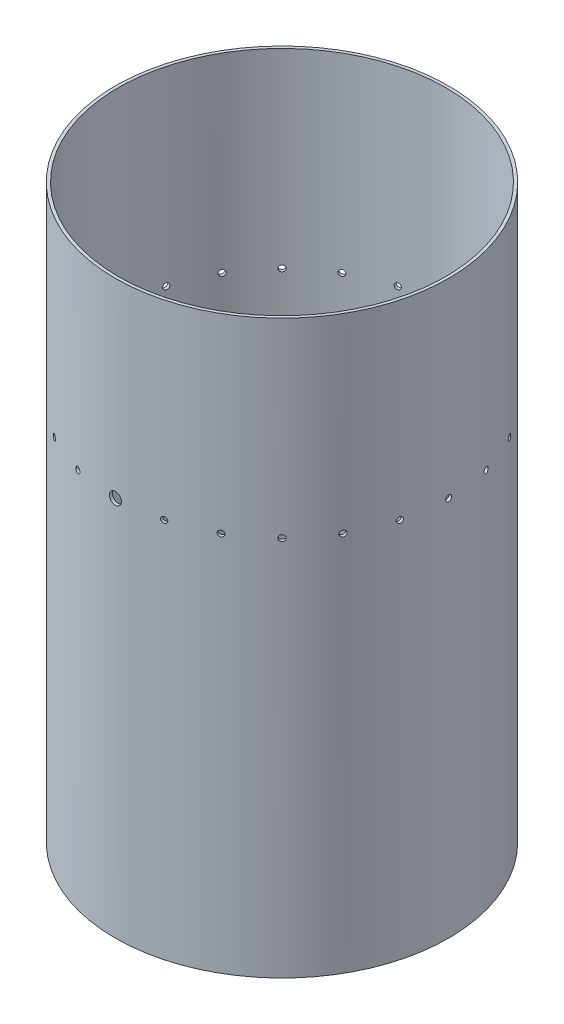
from build123d import *

# Parameters (mm, degrees)
SKETCH1_R               = 88.9
SKETCH1_R_2             = 87.3125
BOSS_EXTRUDE1_DEPTH     = 304.8
SKETCH10_R              = 1.5875
CUT_EXTRUDE1_DEPTH      = 3.81
CIRPATTERN1_COUNT       = 24
CUT_EXTRUDE2_DEPTH      = 364.89433922
CUT_EXTRUDE2_DEPTH_BACK = 364.89433922
SKETCH12_R              = 3.175


with BuildPart() as part:
    # Sketch1 → Boss-Extrude1 (new body)
    with BuildSketch(Plane(origin=(0, 0, 0), x_dir=(1, 0, 0), z_dir=(0, 1, 0))):
        Circle(SKETCH1_R)
        Circle(SKETCH1_R_2, mode=Mode.SUBTRACT)
    extrude(amount=BOSS_EXTRUDE1_DEPTH)

    # Sketch10 → Cut-Extrude1 (cut)
    with BuildSketch(Plane.XY.offset(88.9)):
        with Locations((0, 203.2)):
            Circle(SKETCH10_R)
    cut_extrude1 = extrude(amount=-CUT_EXTRUDE1_DEPTH, mode=Mode.SUBTRACT)

    # CirPattern1: Cut-Extrude1 ×24 about axis
    cirpattern1_axis = Axis((0, 304.8, 0), (0, -1, 0))
    for i in range(1, CIRPATTERN1_COUNT):
        add(cut_extrude1.rotate(cirpattern1_axis, i * 360 / CIRPATTERN1_COUNT), mode=Mode.SUBTRACT)

    # Sketch12 → Cut-Extrude2 (cut, two sides: drawn at the far end of the back side and taken through both)
    with BuildSketch(Plane.XY.offset(88.9).offset(-CUT_EXTRUDE2_DEPTH_BACK)):
        with Locations((0, 203.2)):
            Circle(SKETCH12_R)
    extrude(amount=CUT_EXTRUDE2_DEPTH + CUT_EXTRUDE2_DEPTH_BACK, mode=Mode.SUBTRACT)


solid = part.part
